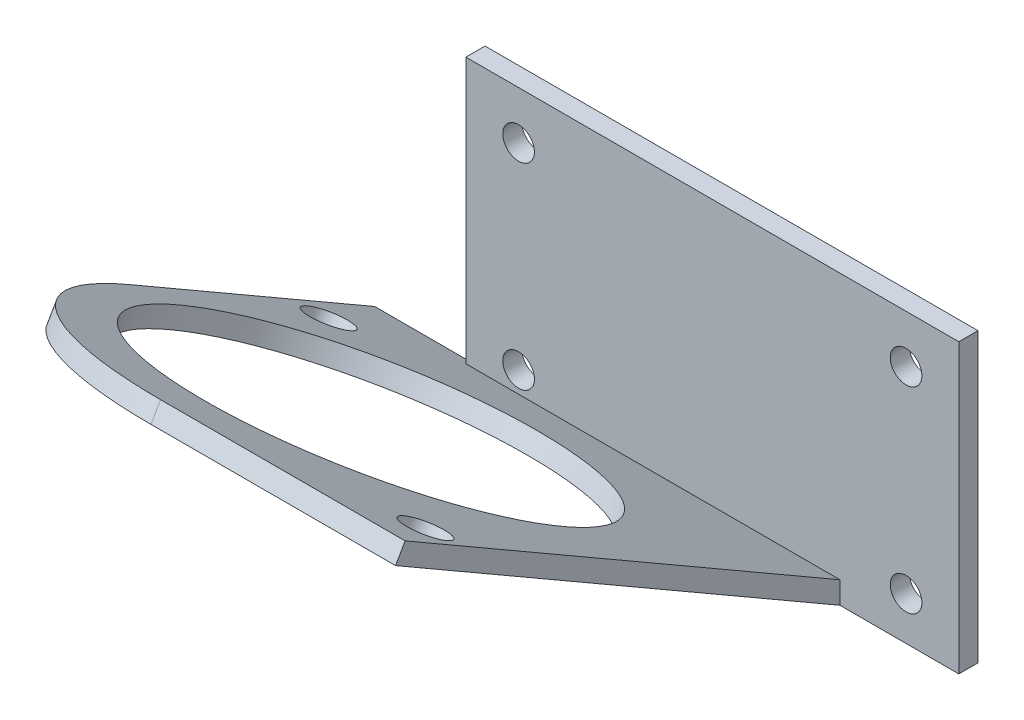
from build123d import *

# Parameters (mm, degrees)
SKETCH1_W           = 51.4
SKETCH1_H           = 30
BOSS_EXTRUDE1_DEPTH = 2
SKETCH2_R           = 1.65
CUT_EXTRUDE1_DEPTH  = 10
SKETCH3_W           = 49.5
SKETCH3_H           = 53.5
BOSS_EXTRUDE2_DEPTH = 2
FILLET1_R           = 24
SKETCH5_R           = 2.25
CUT_EXTRUDE2_DEPTH  = 2
SKETCH6_R           = 20
CUT_EXTRUDE3_DEPTH  = 2


with BuildPart() as part:
    # Sketch1 → Boss-Extrude1 (new body)
    with BuildSketch(Plane.XY):
        with Locations((25.7, 15)):
            Rectangle(SKETCH1_W, SKETCH1_H)
    extrude(amount=BOSS_EXTRUDE1_DEPTH)

    # Sketch2 → Cut-Extrude1 (cut)
    with BuildSketch(Plane(origin=(0, 0, 0), x_dir=(-1, 0, 0), z_dir=(0, 0, -1))):
        with Locations((-45.9, 25)):
            Circle(SKETCH2_R)
        with Locations((-5.5, 25)):
            Circle(SKETCH2_R)
        with Locations((-5.5, 4.5)):
            Circle(SKETCH2_R)
        with Locations((-45.9, 4.5)):
            Circle(SKETCH2_R)
    extrude(amount=-CUT_EXTRUDE1_DEPTH, mode=Mode.SUBTRACT)

    # Sketch3 → Boss-Extrude2 (add)
    with BuildSketch(Plane(origin=(0, -0.8660254037844364, 0.4999999999999961), x_dir=(1, 0, 0), z_dir=(0, -0.8660254037844398, 0.499999999999998))):
        with Locations((14.25, 28.482050808)):
            Rectangle(SKETCH3_W, SKETCH3_H)
    extrude(amount=-BOSS_EXTRUDE2_DEPTH)

    # Fillet1
    fillet1_edges = [part.edges().sort_by_distance(p)[0] for p in [
        (-10.5, 27.616025404, 47.832359102),
    ]]
    fillet(fillet1_edges, radius=FILLET1_R)

    # Sketch5 → Cut-Extrude2 (cut)
    with BuildSketch(Plane(origin=(0, -0.8660254037844378, 0.4999999999999969), x_dir=(1, 0, 0), z_dir=(0, -0.8660254037844399, 0.49999999999999806))):
        with Locations((35.9, 49.210750739)):
            Circle(SKETCH5_R)
        with Locations((-7.1, 11.210750739)):
            Circle(SKETCH5_R)
    extrude(amount=-CUT_EXTRUDE2_DEPTH, mode=Mode.SUBTRACT)

    # Sketch6 → Cut-Extrude3 (cut)
    with BuildSketch(Plane(origin=(0, -0.8660254037844378, 0.4999999999999969), x_dir=(1, 0, 0), z_dir=(0, -0.8660254037844399, 0.49999999999999806))):
        with Locations((12.9, 29.210750739)):
            Circle(SKETCH6_R)
    extrude(amount=-CUT_EXTRUDE3_DEPTH, mode=Mode.SUBTRACT)


solid = part.part
